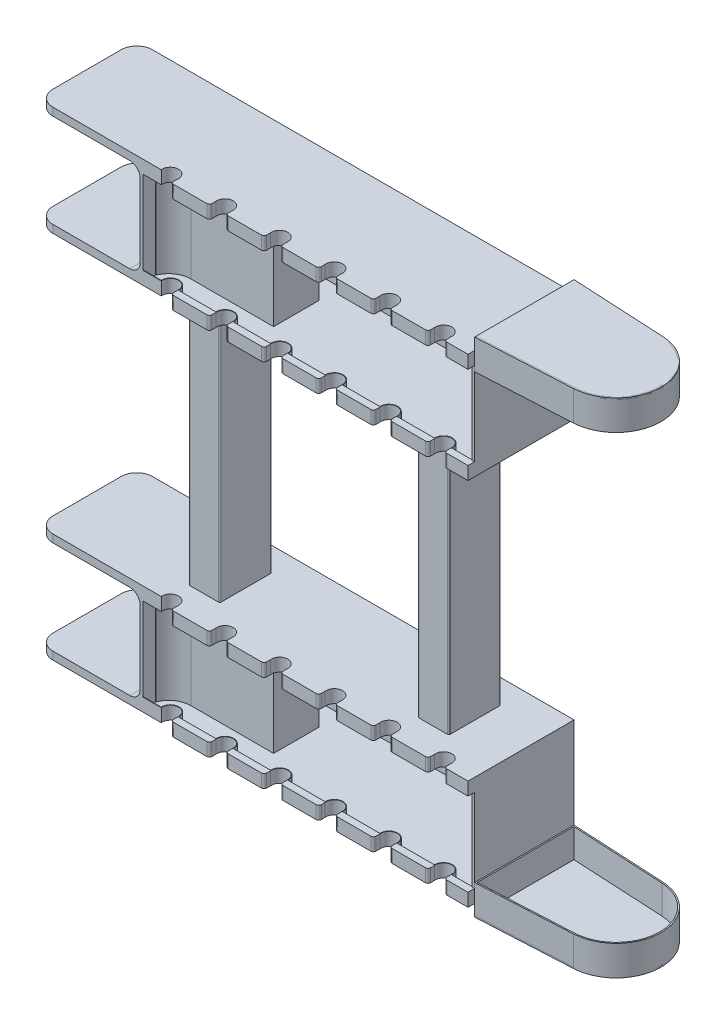
from build123d import *

# Parameters (mm, degrees)
IZIM1_W                                  = 1264.5
IZIM1_H                                  = 400
Y_KSEKLIK_EKSTR_ZYON1_DEPTH              = 191.17
IZIM3_W                                  = 1264.5
IZIM3_H                                  = 400
Y_KSEKLIK_EKSTR_ZYON3_DEPTH              = 20
RADYUS4_R                                = 60
RADYUS6_R                                = 40
Y_KSEKLIK_EKSTR_ZYON7_DEPTH              = 45
Y_KSEKLIK_EKSTR_ZYON7_DEPTH_BACK         = 70
Y_KSEKLIK_EKSTR_ZYON8_DEPTH              = 5
IZIM23_W                                 = 50
IZIM23_H                                 = 30
KES_EKSTR_ZYON7_DEPTH                    = 87.5
IZIM24_R                                 = 3
KES_EKSTR_ZYON8_DEPTH                    = 20
KES_EKSTR_ZYON9_REACH                    = 1403.712
KES_EKSTR_ZYON9_DIRECTION_2_REACH        = 1403.712
Y_KSEKLIK_EKSTR_ZYON11_REACH             = 1403.712
Y_KSEKLIK_EKSTR_ZYON11_DIRECTION_2_REACH = 1403.712
Y_KSEKLIK_EKSTR_ZYON18_DEPTH             = 1000
Y_KSEKLIK_EKSTR_ZYON18_2_DEPTH           = 1000
IZIM32_R                                 = 31.5
KES_EKSTR_ZYON10_DEPTH                   = 592
Y_KSEKLIK_EKSTR_ZYON19_DEPTH             = 40
IZIM34_W                                 = 147.39009663
IZIM34_H                                 = 50
Y_KSEKLIK_EKSTR_ZYON20_DEPTH             = 25
RADYUS7_R                                = 10
RADYUS7_OF_AYNALAMA6_R                   = 10
Y_KSEKLIK_EKSTR_ZYON21_REACH             = 1838.86
Y_KSEKLIK_EKSTR_ZYON21_DIRECTION_2_REACH = 1838.86
Y_KSEKLIK_EKSTR_ZYON23_DEPTH             = 2


with BuildPart() as part:
    # Çizim1 → Yükseklik-Ekstrüzyon1 (new, symmetric)
    with BuildSketch(Plane.XY):
        Polygon((-840, -20), (-840, 10), (-444.5, 10), (-444.5, 370), (-840, 370), (-840, 400), (840, 400), (840, -20), align=None)
        with Locations((197.75, 190)):
            Rectangle(IZIM1_W, IZIM1_H, mode=Mode.SUBTRACT)
    extrude(amount=Y_KSEKLIK_EKSTR_ZYON1_DEPTH, both=True)

    # Çizim3 → Yükseklik-Ekstrüzyon3 (add)
    with BuildSketch(Plane(origin=(0, 0, -191.17), x_dir=(-1, 0, 0), z_dir=(0, 0, -1))):
        with Locations((-197.75, 190)):
            Rectangle(IZIM3_W, IZIM3_H)
    extrude(amount=-Y_KSEKLIK_EKSTR_ZYON3_DEPTH)

    # Radyus4
    radyus4_edges = [part.edges().sort_by_distance(p)[0] for p in [
        (-840, -5, -191.17),
        (-840, 385, -191.17),
        (-840, -5, 191.17),
        (-840, 385, 191.17),
    ]]
    fillet(radyus4_edges, radius=RADYUS4_R)

    # Radyus6
    radyus6_edges = [part.edges().sort_by_distance(p)[0] for p in [
        (-444.5, 10, 0),
        (-444.5, 370, 0),
    ]]
    fillet(radyus6_edges, radius=RADYUS6_R)

    # Çizim23 → Kes-Ekstrüzyon7 (cut, symmetric)
    with BuildSketch(Plane(origin=(0, 190, 0), x_dir=(-1, 0, 0), z_dir=(0, -1, 0))):
        Polygon((-247.75, 191.17), (-197.75, 191.17), (-147.75, 191.17), (-147.75, 202.955305559), (-247.75, 202.955305559), align=None)
        with Locations((-172.75, 176.17)):
            Rectangle(IZIM23_W, IZIM23_H)
        with Locations((-222.75, 176.17)):
            Rectangle(IZIM23_W, IZIM23_H)
    extrude(amount=KES_EKSTR_ZYON7_DEPTH, both=True, mode=Mode.SUBTRACT)

    # Çizim24 → Kes-Ekstrüzyon8 (cut)
    with BuildSketch(Plane(origin=(0, 0, -191.17), x_dir=(-1, 0, 0), z_dir=(0, 0, -1))):
        with Locations((-197.75, 83.5)):
            Circle(IZIM24_R)
    extrude(amount=-KES_EKSTR_ZYON8_DEPTH, mode=Mode.SUBTRACT)

    # Kes-Ekstrüzyon9: up to this face of the body (flat: up to its plane)
    kes_ekstr_zyon9_end = Plane(part.part.faces().sort_by_distance((-660.360242568, 10, 0))[0])
    # Çizim25 → Kes-Ekstrüzyon9 (cut, up to the picked face)
    with BuildSketch(Plane(origin=(0, 190, 0), x_dir=(1, 0, 0), z_dir=(0, 1, 0)), mode=Mode.PRIVATE) as kes_ekstr_zyon9_sk1:
        with BuildLine():
            Line((-349.138027569, 82.530338995), (-40.679003248, 82.530338995))
            Line((-40.679003248, 82.530338995), (-40.679003248, -82.530338995))
            Line((-40.679003248, -82.530338995), (-353.340167588, -82.530338995))
            ThreePointArc((-353.340167588, -82.530338995), (-403.068425437, -97.516337826), (-436.236069641, -137.483664076))
            Line((-436.236069641, -137.483664076), (-444.5, -137.483664076))
            Line((-444.5, -137.483664076), (-444.5, 137.483664076))
            Line((-444.5, 137.483664076), (-432.033929622, 137.483664076))
            ThreePointArc((-432.033929622, 137.483664076), (-398.866285418, 97.516337826), (-349.138027569, 82.530338995))
        make_face()
    kes_ekstr_zyon9_tool1 = split(extrude(kes_ekstr_zyon9_sk1.sketch, amount=-KES_EKSTR_ZYON9_REACH, mode=Mode.PRIVATE), bisect_by=kes_ekstr_zyon9_end, keep=Keep.BOTH, mode=Mode.PRIVATE)
    add(kes_ekstr_zyon9_tool1.solids().sort_by(Axis((-251.976758, 190, -0.361214), (0, -1, 0)))[0], mode=Mode.SUBTRACT)

    # Kes-Ekstrüzyon9 direction 2: up to this face of the body (flat: up to its plane)
    kes_ekstr_zyon9_direction_2_end = Plane(part.part.faces().sort_by_distance((-660.360242568, 370, 0))[0])
    # Çizim25 → Kes-Ekstrüzyon9 direction 2 (cut, up to the picked face)
    with BuildSketch(Plane(origin=(0, 190, 0), x_dir=(1, 0, 0), z_dir=(0, 1, 0)), mode=Mode.PRIVATE) as kes_ekstr_zyon9_direction_2_sk1:
        with BuildLine():
            Line((-349.138027569, 82.530338995), (-40.679003248, 82.530338995))
            Line((-40.679003248, 82.530338995), (-40.679003248, -82.530338995))
            Line((-40.679003248, -82.530338995), (-353.340167588, -82.530338995))
            ThreePointArc((-353.340167588, -82.530338995), (-403.068425437, -97.516337826), (-436.236069641, -137.483664076))
            Line((-436.236069641, -137.483664076), (-444.5, -137.483664076))
            Line((-444.5, -137.483664076), (-444.5, 137.483664076))
            Line((-444.5, 137.483664076), (-432.033929622, 137.483664076))
            ThreePointArc((-432.033929622, 137.483664076), (-398.866285418, 97.516337826), (-349.138027569, 82.530338995))
        make_face()
    kes_ekstr_zyon9_direction_2_tool1 = split(extrude(kes_ekstr_zyon9_direction_2_sk1.sketch, amount=KES_EKSTR_ZYON9_DIRECTION_2_REACH, mode=Mode.PRIVATE), bisect_by=kes_ekstr_zyon9_direction_2_end, keep=Keep.BOTH, mode=Mode.PRIVATE)
    add(kes_ekstr_zyon9_direction_2_tool1.solids().sort_by(Axis((-251.976758, 190, -0.361214), (0, 1, 0)))[0], mode=Mode.SUBTRACT)

    # Yükseklik-Ekstrüzyon11: up to this face of the body (flat: up to its plane)
    y_kseklik_ekstr_zyon11_end = Plane(part.part.faces().sort_by_distance((197.75, 390, 10))[0])
    # Çizim25<6> → Yükseklik-Ekstrüzyon11 (add, up to the picked face)
    with BuildSketch(Plane(origin=(0, 190, 0), x_dir=(1, 0, 0), z_dir=(0, 1, 0)), mode=Mode.PRIVATE) as y_kseklik_ekstr_zyon11_sk1:
        with BuildLine():
            ThreePointArc((-432.033929622, 137.483664076), (-398.866285418, 97.516337826), (-349.138027569, 82.530338995))
            Line((-349.138027569, 82.530338995), (-40.679003248, 82.530338995))
            Line((-40.679003248, 82.530338995), (-40.679003248, -82.530338995))
            Line((-40.679003248, -82.530338995), (-353.340167588, -82.530338995))
            ThreePointArc((-353.340167588, -82.530338995), (-403.068425437, -97.516337826), (-436.236069641, -137.483664076))
            Line((-436.236069641, -137.483664076), (-444.5, -137.483664076))
            Line((-444.5, -137.483664076), (-444.5, -142.483664076))
            Line((-444.5, -142.483664076), (-432.85241398, -142.483664076))
            ThreePointArc((-432.85241398, -142.483664076), (-401.667347477, -102.605495884), (-353.340167588, -87.530338995))
            Line((-353.340167588, -87.530338995), (-35.679003248, -87.530338995))
            Line((-35.679003248, -87.530338995), (-35.679003248, 87.530338995))
            Line((-35.679003248, 87.530338995), (-349.138027569, 87.530338995))
            ThreePointArc((-349.138027569, 87.530338995), (-397.465207458, 102.605495884), (-428.650273962, 142.483664076))
            Line((-428.650273962, 142.483664076), (-444.5, 142.483664076))
            Line((-444.5, 142.483664076), (-444.5, 137.483664076))
            Line((-444.5, 137.483664076), (-432.033929622, 137.483664076))
        make_face()
    y_kseklik_ekstr_zyon11_tool1 = split(extrude(y_kseklik_ekstr_zyon11_sk1.sketch, amount=Y_KSEKLIK_EKSTR_ZYON11_REACH, mode=Mode.PRIVATE), bisect_by=y_kseklik_ekstr_zyon11_end, keep=Keep.BOTH, mode=Mode.PRIVATE)
    add(y_kseklik_ekstr_zyon11_tool1.solids().sort_by(Axis((-438.266965, 190, -142.467046), (0, 1, 0)))[0])

    # Yükseklik-Ekstrüzyon11 direction 2: up to this face of the body (flat: up to its plane)
    y_kseklik_ekstr_zyon11_direction_2_end = Plane(part.part.faces().sort_by_distance((197.75, -10, 10))[0])
    # Çizim25<6> → Yükseklik-Ekstrüzyon11 direction 2 (add, up to the picked face)
    with BuildSketch(Plane(origin=(0, 190, 0), x_dir=(1, 0, 0), z_dir=(0, 1, 0)), mode=Mode.PRIVATE) as y_kseklik_ekstr_zyon11_direction_2_sk1:
        with BuildLine():
            ThreePointArc((-432.033929622, 137.483664076), (-398.866285418, 97.516337826), (-349.138027569, 82.530338995))
            Line((-349.138027569, 82.530338995), (-40.679003248, 82.530338995))
            Line((-40.679003248, 82.530338995), (-40.679003248, -82.530338995))
            Line((-40.679003248, -82.530338995), (-353.340167588, -82.530338995))
            ThreePointArc((-353.340167588, -82.530338995), (-403.068425437, -97.516337826), (-436.236069641, -137.483664076))
            Line((-436.236069641, -137.483664076), (-444.5, -137.483664076))
            Line((-444.5, -137.483664076), (-444.5, -142.483664076))
            Line((-444.5, -142.483664076), (-432.85241398, -142.483664076))
            ThreePointArc((-432.85241398, -142.483664076), (-401.667347477, -102.605495884), (-353.340167588, -87.530338995))
            Line((-353.340167588, -87.530338995), (-35.679003248, -87.530338995))
            Line((-35.679003248, -87.530338995), (-35.679003248, 87.530338995))
            Line((-35.679003248, 87.530338995), (-349.138027569, 87.530338995))
            ThreePointArc((-349.138027569, 87.530338995), (-397.465207458, 102.605495884), (-428.650273962, 142.483664076))
            Line((-428.650273962, 142.483664076), (-444.5, 142.483664076))
            Line((-444.5, 142.483664076), (-444.5, 137.483664076))
            Line((-444.5, 137.483664076), (-432.033929622, 137.483664076))
        make_face()
    y_kseklik_ekstr_zyon11_direction_2_tool1 = split(extrude(y_kseklik_ekstr_zyon11_direction_2_sk1.sketch, amount=-Y_KSEKLIK_EKSTR_ZYON11_DIRECTION_2_REACH, mode=Mode.PRIVATE), bisect_by=y_kseklik_ekstr_zyon11_direction_2_end, keep=Keep.BOTH, mode=Mode.PRIVATE)
    add(y_kseklik_ekstr_zyon11_direction_2_tool1.solids().sort_by(Axis((-438.266965, 190, -142.467046), (0, -1, 0)))[0])

    # Çizim32 → Kes-Ekstrüzyon10 (cut)
    with BuildSketch(Plane.XZ.offset(20)):
        with Locations((717.62, 187.67)):
            Circle(IZIM32_R)
        with Locations((507.62, 187.67)):
            Circle(IZIM32_R)
        with Locations((297.62, 187.67)):
            Circle(IZIM32_R)
        with Locations((87.62, 187.67)):
            Circle(IZIM32_R)
        with Locations((-122.38, 187.67)):
            Circle(IZIM32_R)
        with Locations((-332.38, 187.67)):
            Circle(IZIM32_R)
    extrude(amount=-KES_EKSTR_ZYON10_DEPTH, mode=Mode.SUBTRACT)

    # Çizim33 → Yükseklik-Ekstrüzyon19 (add)
    with BuildSketch(Plane(origin=(0, -10, 0), x_dir=(1, 0, 0), z_dir=(0, 1, 0))):
        with BuildLine():
            Line((-434.5, -189.17), (-434.5, -191.17))
            Line((-434.5, -191.17), (-363.684951685, -191.17))
            ThreePointArc((-363.684951685, -191.17), (-332.38, -156.17), (-301.075048315, -191.17))
            Line((-301.075048315, -191.17), (-153.684951685, -191.17))
            ThreePointArc((-153.684951685, -191.17), (-122.38, -156.17), (-91.075048315, -191.17))
            Line((-91.075048315, -191.17), (56.315048315, -191.17))
            ThreePointArc((56.315048315, -191.17), (87.62, -156.17), (118.924951685, -191.17))
            Line((118.924951685, -191.17), (266.315048315, -191.17))
            ThreePointArc((266.315048315, -191.17), (297.62, -156.17), (328.924951685, -191.17))
            Line((328.924951685, -191.17), (476.315048315, -191.17))
            ThreePointArc((476.315048315, -191.17), (507.62, -156.17), (538.924951685, -191.17))
            Line((538.924951685, -191.17), (686.315048315, -191.17))
            ThreePointArc((686.315048315, -191.17), (717.62, -156.17), (748.924951685, -191.17))
            Line((748.924951685, -191.17), (830, -191.17))
            Line((830, -191.17), (830, -189.17))
            Line((830, -189.17), (751.086401061, -189.17))
            ThreePointArc((751.086401061, -189.17), (717.62, -154.17), (684.153598939, -189.17))
            Line((684.153598939, -189.17), (541.086401061, -189.17))
            ThreePointArc((541.086401061, -189.17), (507.62, -154.17), (474.153598939, -189.17))
            Line((474.153598939, -189.17), (331.086401061, -189.17))
            ThreePointArc((331.086401061, -189.17), (297.62, -154.17), (264.153598939, -189.17))
            Line((264.153598939, -189.17), (121.086401061, -189.17))
            ThreePointArc((121.086401061, -189.17), (87.62, -154.17), (54.153598939, -189.17))
            Line((54.153598939, -189.17), (-88.913598939, -189.17))
            ThreePointArc((-88.913598939, -189.17), (-122.38, -154.17), (-155.846401061, -189.17))
            Line((-155.846401061, -189.17), (-298.913598939, -189.17))
            ThreePointArc((-298.913598939, -189.17), (-332.38, -154.17), (-365.846401061, -189.17))
            Line((-365.846401061, -189.17), (-434.5, -189.17))
        make_face()
    y_kseklik_ekstr_zyon19 = extrude(amount=Y_KSEKLIK_EKSTR_ZYON19_DEPTH)

    # Aynalama5: Yükseklik-Ekstrüzyon19 across plane
    add(y_kseklik_ekstr_zyon19.mirror(Plane(origin=(0, 190, 0), x_dir=(0, 0, 1), z_dir=(0, -1, 0))))

    # Çizim34 → Yükseklik-Ekstrüzyon20 (add)
    with BuildSketch(Plane.XY.offset(191.17)):
        with Locations((-227.38, 5)):
            Rectangle(IZIM34_W, IZIM34_H)
        with Locations((-17.38, 5)):
            Rectangle(IZIM34_W, IZIM34_H)
        with Locations((192.62, 5)):
            Rectangle(IZIM34_W, IZIM34_H)
        with Locations((402.62, 5)):
            Rectangle(IZIM34_W, IZIM34_H)
        with Locations((612.62, 5)):
            Rectangle(IZIM34_W, IZIM34_H)
        Polygon((748.924951685, 30), (830, 30), (840, 30), (840, -20), (748.924951685, -20), align=None)
    y_kseklik_ekstr_zyon20 = extrude(amount=Y_KSEKLIK_EKSTR_ZYON20_DEPTH)

    # Radyus7
    radyus7_edges = [part.edges().sort_by_distance(p)[0] for p in [
        (748.924951685, 5, 216.17),
        (686.315048315, 5, 216.17),
        (538.924951685, 5, 216.17),
        (476.315048315, 5, 216.17),
        (328.924951685, 5, 216.17),
        (266.315048315, 5, 216.17),
        (118.924951685, 5, 216.17),
        (-91.075048315, 5, 216.17),
        (56.315048315, 5, 216.17),
        (-153.684951685, 5, 216.17),
        (-301.075048315, 5, 216.17),
    ]]
    fillet(radyus7_edges, radius=RADYUS7_R)

    # Aynalama6: Yükseklik-Ekstrüzyon20 across plane
    add(y_kseklik_ekstr_zyon20.mirror(Plane.ZX.offset(190)))

    # Radyus7 of Aynalama6
    radyus7_of_aynalama6_edges = [part.edges().sort_by_distance(p)[0] for p in [
        (748.924951685, 375, 216.17),
        (686.315048315, 375, 216.17),
        (538.924951685, 375, 216.17),
        (476.315048315, 375, 216.17),
        (328.924951685, 375, 216.17),
        (266.315048315, 375, 216.17),
        (118.924951685, 375, 216.17),
        (-91.075048315, 375, 216.17),
        (56.315048315, 375, 216.17),
        (-153.684951685, 375, 216.17),
        (-301.075048315, 375, 216.17),
    ]]
    fillet(radyus7_of_aynalama6_edges, radius=RADYUS7_OF_AYNALAMA6_R)

    # Yükseklik-Ekstrüzyon21: up to this face of the body (flat: up to its plane)
    y_kseklik_ekstr_zyon21_end = Plane(part.part.faces().sort_by_distance((197.75, 102.5, -181.17))[0])
    # Çizim37 → Yükseklik-Ekstrüzyon21 (add, up to the picked face)
    with BuildSketch(Plane(origin=(0, 190, 0), x_dir=(1, 0, 0), z_dir=(0, 1, 0)), mode=Mode.PRIVATE) as y_kseklik_ekstr_zyon21_sk1:
        Polygon((168.609393183, 150.310606817), (147.75, 171.17), (144.921572875, 171.17), (146.335786438, 169.755786438), (167.780966059, 148.310606817), (197.75, 148.310606817), (197.75, 150.310606817), align=None)
    y_kseklik_ekstr_zyon21_tool1 = split(extrude(y_kseklik_ekstr_zyon21_sk1.sketch, amount=-Y_KSEKLIK_EKSTR_ZYON21_REACH, mode=Mode.PRIVATE), bisect_by=y_kseklik_ekstr_zyon21_end, keep=Keep.BOTH, mode=Mode.PRIVATE)
    # Çizim37 → Yükseklik-Ekstrüzyon21 (add, up to the picked face)
    with BuildSketch(Plane(origin=(0, 190, 0), x_dir=(1, 0, 0), z_dir=(0, 1, 0)), mode=Mode.PRIVATE) as y_kseklik_ekstr_zyon21_sk2:
        Polygon((226.890606817, 150.310606817), (197.75, 150.310606817), (197.75, 148.310606817), (227.719033941, 148.310606817), (249.164213562, 169.755786438), (250.578427125, 171.17), (247.75, 171.17), align=None)
    y_kseklik_ekstr_zyon21_tool2 = split(extrude(y_kseklik_ekstr_zyon21_sk2.sketch, amount=-Y_KSEKLIK_EKSTR_ZYON21_REACH, mode=Mode.PRIVATE), bisect_by=y_kseklik_ekstr_zyon21_end, keep=Keep.BOTH, mode=Mode.PRIVATE)
    add(y_kseklik_ekstr_zyon21_tool1.solids().sort_by(Axis((157.772671, 190, -160.333278), (0, -1, 0)))[0])
    add(y_kseklik_ekstr_zyon21_tool2.solids().sort_by(Axis((212.320303, 190, -149.734986), (0, -1, 0)))[0])

    # Yükseklik-Ekstrüzyon21 direction 2: up to this face of the body (flat: up to its plane)
    y_kseklik_ekstr_zyon21_direction_2_end = Plane(part.part.faces().sort_by_distance((197.75, 277.5, -181.17))[0])
    # Çizim37 → Yükseklik-Ekstrüzyon21 direction 2 (add, up to the picked face)
    with BuildSketch(Plane(origin=(0, 190, 0), x_dir=(1, 0, 0), z_dir=(0, 1, 0)), mode=Mode.PRIVATE) as y_kseklik_ekstr_zyon21_direction_2_sk1:
        Polygon((168.609393183, 150.310606817), (147.75, 171.17), (144.921572875, 171.17), (146.335786438, 169.755786438), (167.780966059, 148.310606817), (197.75, 148.310606817), (197.75, 150.310606817), align=None)
    y_kseklik_ekstr_zyon21_direction_2_tool1 = split(extrude(y_kseklik_ekstr_zyon21_direction_2_sk1.sketch, amount=Y_KSEKLIK_EKSTR_ZYON21_DIRECTION_2_REACH, mode=Mode.PRIVATE), bisect_by=y_kseklik_ekstr_zyon21_direction_2_end, keep=Keep.BOTH, mode=Mode.PRIVATE)
    # Çizim37 → Yükseklik-Ekstrüzyon21 direction 2 (add, up to the picked face)
    with BuildSketch(Plane(origin=(0, 190, 0), x_dir=(1, 0, 0), z_dir=(0, 1, 0)), mode=Mode.PRIVATE) as y_kseklik_ekstr_zyon21_direction_2_sk2:
        Polygon((226.890606817, 150.310606817), (197.75, 150.310606817), (197.75, 148.310606817), (227.719033941, 148.310606817), (249.164213562, 169.755786438), (250.578427125, 171.17), (247.75, 171.17), align=None)
    y_kseklik_ekstr_zyon21_direction_2_tool2 = split(extrude(y_kseklik_ekstr_zyon21_direction_2_sk2.sketch, amount=Y_KSEKLIK_EKSTR_ZYON21_DIRECTION_2_REACH, mode=Mode.PRIVATE), bisect_by=y_kseklik_ekstr_zyon21_direction_2_end, keep=Keep.BOTH, mode=Mode.PRIVATE)
    add(y_kseklik_ekstr_zyon21_direction_2_tool1.solids().sort_by(Axis((157.772671, 190, -160.333278), (0, 1, 0)))[0])
    add(y_kseklik_ekstr_zyon21_direction_2_tool2.solids().sort_by(Axis((212.320303, 190, -149.734986), (0, 1, 0)))[0])

    # Çizim38 → Yükseklik-Ekstrüzyon23 (add)
    with BuildSketch(Plane(origin=(0, 277.5, 0), x_dir=(1, 0, 0), z_dir=(0, 1, 0))):
        Polygon((168.609393183, 150.310606817), (147.75, 171.17), (144.921572875, 171.17), (167.780966059, 148.310606817), (227.719033941, 148.310606817), (250.578427125, 171.17), (247.75, 171.17), (226.890606817, 150.310606817), align=None)
        Polygon((247.75, 171.17), (147.75, 171.17), (168.609393183, 150.310606817), (226.890606817, 150.310606817), align=None)
    y_kseklik_ekstr_zyon23 = extrude(amount=Y_KSEKLIK_EKSTR_ZYON23_DEPTH)

    # Aynalama7: Yükseklik-Ekstrüzyon23 across plane
    add(y_kseklik_ekstr_zyon23.mirror(Plane(origin=(0, 190, 0), x_dir=(0, 0, 1), z_dir=(0, -1, 0))))


with BuildPart() as body_2:
    # Çizim16 → Yükseklik-Ekstrüzyon7 (new, two sides: drawn at the far end of the back side and taken through both)
    with BuildSketch(Plane.XZ.offset(20).offset(-Y_KSEKLIK_EKSTR_ZYON7_DEPTH_BACK)):
        with BuildLine():
            Line((1201.508720242, 172.264601586), (840, 191.17))
            Line((840, 191.17), (840, 5))
            Line((840, 5), (845, 5))
            Line((845, 5), (845, 185.901688386))
            Line((845, 185.901688386), (1201.247597916, 167.271424728))
            ThreePointArc((1201.247597916, 167.271424728), (1312.25905514, 117.106868765), (1359.925356503, 5))
            Line((1359.925356503, 5), (1364.927521005, 5))
            ThreePointArc((1364.927521005, 5), (1315.886138384, 120.549205118), (1201.508720242, 172.264601586))
        make_face()
        with BuildLine():
            Line((845, 5), (840, 5))
            Line((840, 5), (840, -191.17))
            Line((840, -191.17), (1201.508720242, -172.264601586))
            ThreePointArc((1201.508720242, -172.264601586), (1319.328475325, -116.922144381), (1364.927521005, 5))
            Line((1364.927521005, 5), (1359.925356503, 5))
            ThreePointArc((1359.925356503, 5), (1315.701414, -113.479784933), (1201.247597916, -167.271424728))
            Line((1201.247597916, -167.271424728), (845, -185.901688386))
            Line((845, -185.901688386), (845, 5))
        make_face()
    extrude(amount=Y_KSEKLIK_EKSTR_ZYON7_DEPTH + Y_KSEKLIK_EKSTR_ZYON7_DEPTH_BACK)


with BuildPart() as body_3:
    # Çizim17 → Yükseklik-Ekstrüzyon8 (new body)
    with BuildSketch(Plane.XZ.offset(65)):
        with BuildLine():
            Line((840, 191.17), (1201.508720242, 172.264601586))
            ThreePointArc((1201.508720242, 172.264601586), (1365, 0), (1201.508720242, -172.264601586))
            Line((1201.508720242, -172.264601586), (840, -191.17))
            Line((840, -191.17), (840, 191.17))
        make_face()
    extrude(amount=-Y_KSEKLIK_EKSTR_ZYON8_DEPTH)


with BuildPart() as body_4:
    # Çizim30 → Yükseklik-Ekstrüzyon18 (new body)
    with BuildSketch(Plane(origin=(0, 400, 0), x_dir=(1, 0, 0), z_dir=(0, 1, 0))):
        with BuildLine():
            Line((-350, 95), (-350, -95))
            ThreePointArc((-350, -95), (-348.535533906, -98.535533906), (-345, -100))
            Line((-345, -100), (-235, -100))
            ThreePointArc((-235, -100), (-231.464466094, -98.535533906), (-230, -95))
            Line((-230, -95), (-230, 95))
            ThreePointArc((-230, 95), (-231.464466094, 98.535533906), (-235, 100))
            Line((-235, 100), (-345, 100))
            ThreePointArc((-345, 100), (-348.535533906, 98.535533906), (-350, 95))
        make_face()
        with BuildLine():
            Line((-346, 92), (-346, -92))
            ThreePointArc((-346, -92), (-344.828427125, -94.828427125), (-342, -96))
            Line((-342, -96), (-238, -96))
            ThreePointArc((-238, -96), (-235.171572875, -94.828427125), (-234, -92))
            Line((-234, -92), (-234, 92))
            ThreePointArc((-234, 92), (-235.171572875, 94.828427125), (-238, 96))
            Line((-238, 96), (-342, 96))
            ThreePointArc((-342, 96), (-344.828427125, 94.828427125), (-346, 92))
        make_face(mode=Mode.SUBTRACT)
    extrude(amount=Y_KSEKLIK_EKSTR_ZYON18_DEPTH)


with BuildPart() as body_5:
    # Çizim30 → Y_kseklik-Ekstr_zyon18 2 (new body)
    with BuildSketch(Plane(origin=(0, 400, 0), x_dir=(1, 0, 0), z_dir=(0, 1, 0))):
        with BuildLine():
            Line((535, -100), (645, -100))
            ThreePointArc((645, -100), (648.535533906, -98.535533906), (650, -95))
            Line((650, -95), (650, 95))
            ThreePointArc((650, 95), (648.535533906, 98.535533906), (645, 100))
            Line((645, 100), (535, 100))
            ThreePointArc((535, 100), (531.464466094, 98.535533906), (530, 95))
            Line((530, 95), (530, -95))
            ThreePointArc((530, -95), (531.464466094, -98.535533906), (535, -100))
        make_face()
        with BuildLine():
            Line((538, -96), (642, -96))
            ThreePointArc((642, -96), (644.828427125, -94.828427125), (646, -92))
            Line((646, -92), (646, 92))
            ThreePointArc((646, 92), (644.828427125, 94.828427125), (642, 96))
            Line((642, 96), (538, 96))
            ThreePointArc((538, 96), (535.171572875, 94.828427125), (534, 92))
            Line((534, 92), (534, -92))
            ThreePointArc((534, -92), (535.171572875, -94.828427125), (538, -96))
        make_face(mode=Mode.SUBTRACT)
    extrude(amount=Y_KSEKLIK_EKSTR_ZYON18_2_DEPTH)


with BuildPart() as body_6:
    # Aynalama8: read off the stored shape, not the designer's step
    # Aynalama8: mirrored copy
    add(body_3.part.mirror(Plane(origin=(0, 900, 0), x_dir=(1, 0, 0), z_dir=(0, 1, 0))))


with BuildPart() as body_7:
    # Aynalama8 2: mirrored copy
    add(body_2.part.mirror(Plane(origin=(0, 900, 0), x_dir=(1, 0, 0), z_dir=(0, 1, 0))))


with BuildPart() as body_8:
    # Aynalama8 3: mirrored copy
    add(part.part.mirror(Plane(origin=(0, 900, 0), x_dir=(1, 0, 0), z_dir=(0, 1, 0))))


solid = Compound([part.part, body_2.part, body_3.part, body_4.part, body_5.part, body_6.part, body_7.part, body_8.part])
